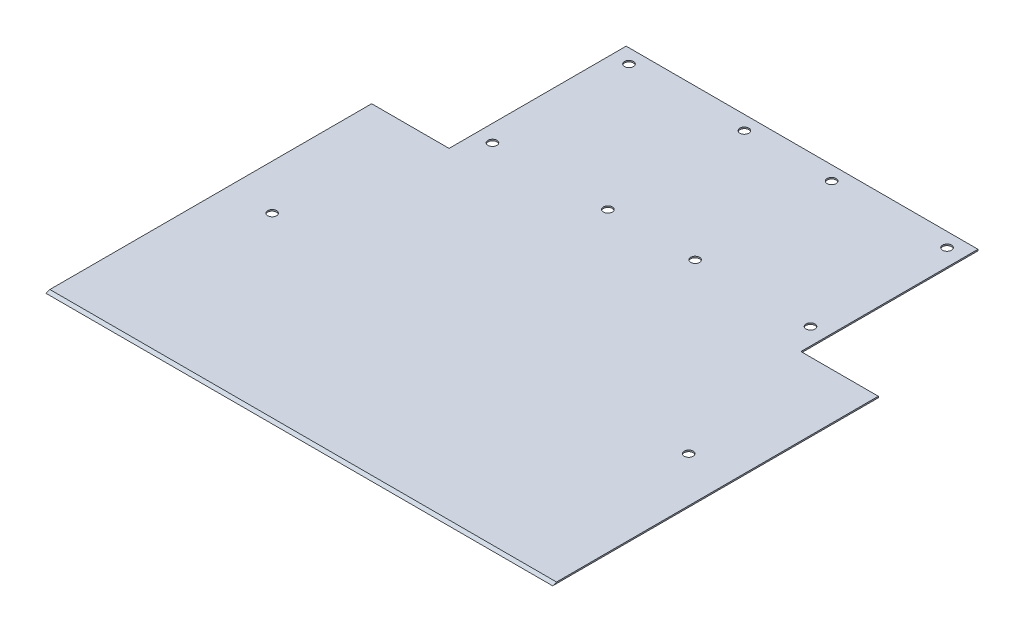
from build123d import *

# Parameters (mm, degrees)
SALIENTE_EXTRUIR1_DEPTH = 0.5
CORTAR_EXTRUIR1_REACH   = 202.939
CORTAR_EXTRUIR3_REACH   = 128.793
CROQUIS5_R              = 1.585
CORTAR_EXTRUIR4_REACH   = 128.793
CROQUIS6_R              = 1.585
CORTAR_EXTRUIR5_REACH   = 128.793
CROQUIS7_R              = 1.585


with BuildPart() as part:
    # Croquis2 → Saliente-Extruir1 (new body)
    with BuildSketch(Plane(origin=(0, 0, 0), x_dir=(1, 0, 0), z_dir=(0, 1, 0))):
        Polygon((-90, 26.39), (-62.5, 26.39), (-62.5, 89.31), (62.5, 89.31), (62.5, 26.39), (90, 26.39), (90, -89.31), (-90, -89.31), align=None)
    extrude(amount=SALIENTE_EXTRUIR1_DEPTH)

    # Croquis3 → Cortar-Extruir1 (cut, up to next)
    with BuildSketch(Plane(origin=(90, 0, 0), x_dir=(0, 0, -1), z_dir=(1, 0, 0)), mode=Mode.PRIVATE) as cortar_extruir1_sk1:
        Polygon((-89.31, 0), (-87.93626129, 0.5), (-89.31, 0.5), align=None)
    cortar_extruir1_tool1 = extrude(cortar_extruir1_sk1.sketch, amount=-CORTAR_EXTRUIR1_REACH, mode=Mode.PRIVATE) & part.part
    add(cortar_extruir1_tool1.solids().sort_by_distance((90, 0.333333, 88.852087))[0], mode=Mode.SUBTRACT)

    # Croquis5 → Cortar-Extruir3 (cut, up to next)
    with BuildSketch(Plane(origin=(0, 0.5, 0), x_dir=(1, 0, 0), z_dir=(0, 1, 0)), mode=Mode.PRIVATE) as cortar_extruir3_sk1:
        with Locations((74, -24.974980583)):
            Circle(CROQUIS5_R)
    cortar_extruir3_tool1 = extrude(cortar_extruir3_sk1.sketch, amount=-CORTAR_EXTRUIR3_REACH, mode=Mode.PRIVATE) & part.part
    cortar_extruir3 = cortar_extruir3_tool1.solids().sort_by_distance((74, 0.5, 24.974981))[0]
    add(cortar_extruir3, mode=Mode.SUBTRACT)

    # Simetría1: Cortar-Extruir3 across plane
    add(cortar_extruir3.mirror(Plane(origin=(0, 0, 0), x_dir=(0, 0, 1), z_dir=(1, 0, 0))), mode=Mode.SUBTRACT)

    # Croquis6 → Cortar-Extruir4 (cut, up to next)
    with BuildSketch(Plane(origin=(0, 0.5, 0), x_dir=(1, 0, 0), z_dir=(0, 1, 0)), mode=Mode.PRIVATE) as cortar_extruir4_sk1:
        with Locations((-56.5, 35.81)):
            Circle(CROQUIS6_R)
    cortar_extruir4_tool1 = extrude(cortar_extruir4_sk1.sketch, amount=-CORTAR_EXTRUIR4_REACH, mode=Mode.PRIVATE) & part.part
    # Croquis6 → Cortar-Extruir4 (cut, up to next)
    with BuildSketch(Plane(origin=(0, 0.5, 0), x_dir=(1, 0, 0), z_dir=(0, 1, 0)), mode=Mode.PRIVATE) as cortar_extruir4_sk2:
        with Locations((-15.5, 35.81)):
            Circle(CROQUIS6_R)
    cortar_extruir4_tool2 = extrude(cortar_extruir4_sk2.sketch, amount=-CORTAR_EXTRUIR4_REACH, mode=Mode.PRIVATE) & part.part
    # Croquis6 → Cortar-Extruir4 (cut, up to next)
    with BuildSketch(Plane(origin=(0, 0.5, 0), x_dir=(1, 0, 0), z_dir=(0, 1, 0)), mode=Mode.PRIVATE) as cortar_extruir4_sk3:
        with Locations((-15.5, 84.31)):
            Circle(CROQUIS6_R)
    cortar_extruir4_tool3 = extrude(cortar_extruir4_sk3.sketch, amount=-CORTAR_EXTRUIR4_REACH, mode=Mode.PRIVATE) & part.part
    # Croquis6 → Cortar-Extruir4 (cut, up to next)
    with BuildSketch(Plane(origin=(0, 0.5, 0), x_dir=(1, 0, 0), z_dir=(0, 1, 0)), mode=Mode.PRIVATE) as cortar_extruir4_sk4:
        with Locations((-56.5, 84.31)):
            Circle(CROQUIS6_R)
    cortar_extruir4_tool4 = extrude(cortar_extruir4_sk4.sketch, amount=-CORTAR_EXTRUIR4_REACH, mode=Mode.PRIVATE) & part.part
    add(cortar_extruir4_tool1.solids().sort_by_distance((-56.5, 0.5, -35.81))[0], mode=Mode.SUBTRACT)
    add(cortar_extruir4_tool2.solids().sort_by_distance((-15.5, 0.5, -35.81))[0], mode=Mode.SUBTRACT)
    add(cortar_extruir4_tool3.solids().sort_by_distance((-15.5, 0.5, -84.31))[0], mode=Mode.SUBTRACT)
    add(cortar_extruir4_tool4.solids().sort_by_distance((-56.5, 0.5, -84.31))[0], mode=Mode.SUBTRACT)

    # Croquis7 → Cortar-Extruir5 (cut, up to next)
    with BuildSketch(Plane(origin=(0, 0.5, 0), x_dir=(1, 0, 0), z_dir=(0, 1, 0)), mode=Mode.PRIVATE) as cortar_extruir5_sk1:
        with Locations((56.5, 35.81)):
            Circle(CROQUIS7_R)
    cortar_extruir5_tool1 = extrude(cortar_extruir5_sk1.sketch, amount=-CORTAR_EXTRUIR5_REACH, mode=Mode.PRIVATE) & part.part
    # Croquis7 → Cortar-Extruir5 (cut, up to next)
    with BuildSketch(Plane(origin=(0, 0.5, 0), x_dir=(1, 0, 0), z_dir=(0, 1, 0)), mode=Mode.PRIVATE) as cortar_extruir5_sk2:
        with Locations((15.5, 35.81)):
            Circle(CROQUIS7_R)
    cortar_extruir5_tool2 = extrude(cortar_extruir5_sk2.sketch, amount=-CORTAR_EXTRUIR5_REACH, mode=Mode.PRIVATE) & part.part
    # Croquis7 → Cortar-Extruir5 (cut, up to next)
    with BuildSketch(Plane(origin=(0, 0.5, 0), x_dir=(1, 0, 0), z_dir=(0, 1, 0)), mode=Mode.PRIVATE) as cortar_extruir5_sk3:
        with Locations((15.5, 84.31)):
            Circle(CROQUIS7_R)
    cortar_extruir5_tool3 = extrude(cortar_extruir5_sk3.sketch, amount=-CORTAR_EXTRUIR5_REACH, mode=Mode.PRIVATE) & part.part
    # Croquis7 → Cortar-Extruir5 (cut, up to next)
    with BuildSketch(Plane(origin=(0, 0.5, 0), x_dir=(1, 0, 0), z_dir=(0, 1, 0)), mode=Mode.PRIVATE) as cortar_extruir5_sk4:
        with Locations((56.5, 84.31)):
            Circle(CROQUIS7_R)
    cortar_extruir5_tool4 = extrude(cortar_extruir5_sk4.sketch, amount=-CORTAR_EXTRUIR5_REACH, mode=Mode.PRIVATE) & part.part
    add(cortar_extruir5_tool1.solids().sort_by_distance((56.5, 0.5, -35.81))[0], mode=Mode.SUBTRACT)
    add(cortar_extruir5_tool2.solids().sort_by_distance((15.5, 0.5, -35.81))[0], mode=Mode.SUBTRACT)
    add(cortar_extruir5_tool3.solids().sort_by_distance((15.5, 0.5, -84.31))[0], mode=Mode.SUBTRACT)
    add(cortar_extruir5_tool4.solids().sort_by_distance((56.5, 0.5, -84.31))[0], mode=Mode.SUBTRACT)


solid = part.part
